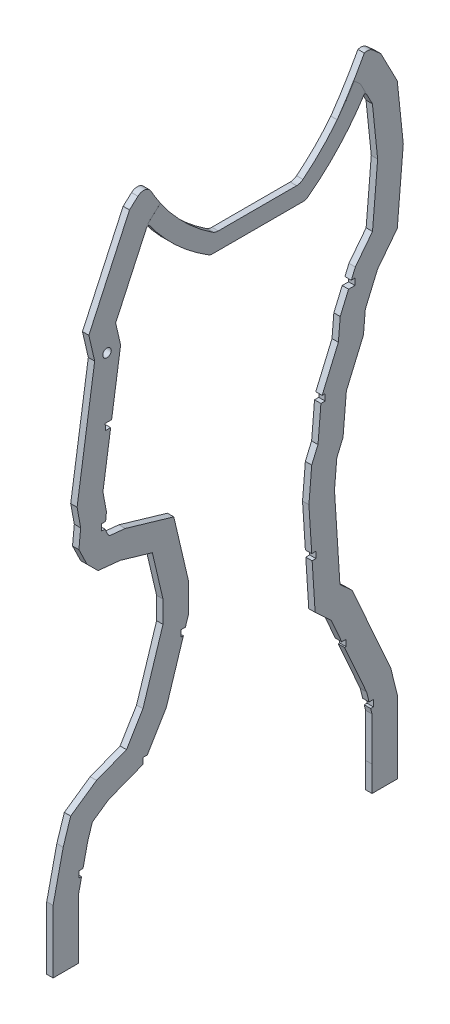
from build123d import *

# Parameters (mm, degrees)
BOSS_EXTRUDE1_DEPTH = 0.0127
BOSS_EXTRUDE2_DEPTH = 4.7625
CUT_EXTRUDE1_DEPTH  = 503.866877
CUT_EXTRUDE2_DEPTH  = 503.866877
CUT_EXTRUDE3_DEPTH  = 503.866877
CUT_EXTRUDE4_DEPTH  = 503.866756562
CUT_EXTRUDE5_DEPTH  = 503.866756562
DRAFT1_ANGLE        = -23.423733099
DRAFT2_ANGLE        = 5.115544643
DRAFT3_ANGLE        = -5.967888323
DRAFT4_ANGLE        = 5.967888323
DRAFT5_ANGLE        = 23.737346389
DRAFT6_ANGLE        = 13.699700153
DRAFT7_ANGLE        = 20.956206915
DRAFT8_ANGLE        = -0.049454377
DRAFT9_ANGLE        = 3.465221439
DRAFT10_ANGLE       = -3.465221439
DRAFT11_START       = -117
DRAFT11_OUTLINE_W   = 4.7625
DRAFT11_OUTLINE_H   = 32.392406503
DRAFT11_DEPTH       = 9.339519007
DRAFT12_ANGLE       = 0.049454377
CHAMFER1_SIZE       = 0.605241869
CHAMFER1_SIZE2      = 1.164909596
CHAMFER2_SIZE       = 9.670928998
CHAMFER2_SIZE2      = 7.254566107
CHAMFER3_SIZE       = 4.192230568
CHAMFER3_SIZE_2     = 1.781251189
CHAMFER4_SIZE       = 8.568336776
CHAMFER4_SIZE2      = 4.451775644
CHAMFER5_SIZE       = 8.906910487
CHAMFER5_SIZE2      = 12.297746559
FILLET1_R           = 5.08
FILLET2_R           = 6.35
FILLET3_R           = 7.62
SKETCH8_R           = 3.175
CUT_EXTRUDE6_DEPTH  = 503.866756562


with BuildPart() as part:
    # Sketch1 → Boss-Extrude1 (new body)
    with BuildSketch(Plane(origin=(-45.3898, 0, 0), x_dir=(0, 0, -1), z_dir=(1, 0, 0))):
        with BuildLine():
            Line((-13.027117867, 411.952661405), (58.2376066, 411.952661405))
            ThreePointArc((58.2376066, 411.952661405), (82.645894032, 433.738757071), (102.578592504, 459.682657922))
            Line((102.578592504, 459.682657922), (98.943932202, 466.704160778))
            Line((98.943932202, 466.704160778), (94.427076157, 470.71914393))
            ThreePointArc((94.427076157, 470.71914393), (76.393067454, 445.761223724), (53.975399251, 424.652661405))
            Line((53.975399251, 424.652661405), (-9.412118588, 424.652661405))
            ThreePointArc((-9.412118588, 424.652661405), (-32.493316198, 442.967669513), (-51.307892988, 465.643491556))
            Line((-51.307892988, 465.643491556), (-60.806367703, 457.019876355))
            ThreePointArc((-60.806367703, 457.019876355), (-39.331205359, 431.926509848), (-13.027117867, 411.952661405))
        make_face()
    extrude(amount=-BOSS_EXTRUDE1_DEPTH)

    # Sketch2 → Boss-Extrude2 (add)
    with BuildSketch(Plane.ZY.offset(45.4025)):
        with BuildLine():
            Line((63.098500001, 63.077602974), (63.291879008, 112.289723034))
            Line((63.291879008, 112.289723034), (60.11690352, 112.302199099))
            Line((60.11690352, 112.302199099), (45.891151151, 135.910086956))
            Line((45.891151151, 135.910086956), (29.332811414, 187.904334246))
            Line((29.332811414, 187.904334246), (29.332811414, 209.391021623))
            Line((29.332811414, 209.391021623), (40.312142586, 256.358160528))
            Line((40.312142586, 256.358160528), (76.579075699, 266.969790755))
            Line((76.579075699, 266.969790755), (88.839020466, 268.202734319))
            Line((88.839020466, 268.202734319), (91.680534506, 274.027275603))
            Line((91.680534506, 274.027275603), (91.68083764, 274.104418767))
            Line((91.68083764, 274.104418767), (94.357956542, 274.093899029))
            Line((94.357956542, 274.093899029), (94.37667064, 278.856362261))
            Line((94.37667064, 278.856362261), (91.201695152, 278.868838325))
            Line((91.201695152, 278.868838325), (91.238314866, 288.188018226))
            Line((91.238314866, 288.188018226), (93.223805533, 298.995347166))
            Line((93.223805533, 298.995347166), (80.018928963, 387.356885758))
            Line((80.018928963, 387.356885758), (83.715153611, 403.40626313))
            Line((83.715153611, 403.40626313), (60.639482355, 453.476115857))
            ThreePointArc((60.639482355, 453.476115857), (59.610055268, 454.208482516), (58.457946256, 453.690094752))
            ThreePointArc((58.457946256, 453.690094752), (37.83997486, 430.538330076), (13.027117867, 411.952661405))
            Line((13.027117867, 411.952661405), (-58.2376066, 411.952661405))
            ThreePointArc((-58.2376066, 411.952661405), (-81.896078346, 432.936686808), (-101.39751725, 457.831394844))
            ThreePointArc((-101.39751725, 457.831394844), (-102.525122265, 458.410155941), (-103.591729488, 457.725461477))
            Line((-103.591729488, 457.725461477), (-107.966767627, 449.273683253))
            Line((-107.966767627, 449.273683253), (-111.881642193, 411.593015556))
            Line((-111.881642193, 411.593015556), (-108.039976128, 366.693543428))
            Line((-108.039976128, 366.693543428), (-92.201907276, 346.218638937))
            Line((-92.201907276, 346.218638937), (-92.214201021, 343.09006127))
            Line((-92.214201021, 343.09006127), (-94.913419834, 343.100667849))
            Line((-94.913419834, 343.100667849), (-94.932133931, 338.338204617))
            Line((-94.932133931, 338.338204617), (-90.1696707, 338.31949052))
            Line((-90.1696707, 338.31949052), (-83.935257282, 323.772525879))
            Line((-83.935257282, 323.772525879), (-82.57036198, 307.820312032))
            Line((-82.57036198, 307.820312032), (-70.434794903, 279.503988853))
            Line((-70.434794903, 279.503988853), (-72.674480904, 279.512789698))
            Line((-72.674480904, 279.512789698), (-72.693195002, 274.750326466))
            Line((-72.693195002, 274.750326466), (-65.772846516, 274.72313296))
            Line((-65.772846516, 274.72313296), (-62.454891666, 235.944535654))
            Line((-62.454891666, 235.944535654), (-62.670608684, 181.0477196))
            Line((-62.670608684, 181.0477196), (-65.845584172, 181.060195665))
            Line((-65.845584172, 181.060195665), (-65.86429827, 176.297732434))
            Line((-65.86429827, 176.297732434), (-62.977705988, 176.28638957))
            Line((-62.977705988, 176.28638957), (-63.227227287, 112.786879815))
            Line((-63.227227287, 112.786879815), (-88.259006751, 112.885242183))
            Line((-88.259006751, 112.885242183), (-88.277720849, 108.122778952))
            Line((-88.277720849, 108.122778952), (-87.197024048, 108.118532354))
            Line((-87.197024048, 108.118532354), (-105.452076716, 67.044663851))
            Line((-105.452076716, 67.044663851), (-105.465062496, 63.73997343))
            Line((-105.465062496, 63.73997343), (-108.640037983, 63.752449495))
            Line((-108.640037983, 63.752449495), (-108.658752081, 58.989986263))
            Line((-108.658752081, 58.989986263), (-106.644713581, 58.9820721))
            Line((-106.644713581, 58.9820721), (-115.689979538, 22.499688915))
            Line((-115.689979538, 22.499688915), (-107.660480993, 22.492758318))
            Line((-107.660480993, 22.492758318), (-107.67690966, 3.459194076))
            Line((-107.67690966, 3.459194076), (-126.710480993, 3.459194076))
            Line((-126.710480993, 3.459194076), (-126.710480993, 66.118439508))
            Line((-126.710480993, 66.118439508), (-92.909897604, 142.169752132))
            Line((-92.909897604, 142.169752132), (-83.719650595, 150.6676735))
            Line((-83.719650595, 150.6676735), (-79.661502452, 213.586437078))
            Line((-79.661502452, 213.586437078), (-81.380621848, 233.678645015))
            Line((-81.380621848, 233.678645015), (-86.058679342, 244.5941125))
            Line((-86.058679342, 244.5941125), (-88.518059029, 273.338112591))
            Line((-88.518059029, 273.338112591), (-101.28931463, 303.137708994))
            Line((-101.28931463, 303.137708994), (-102.654209933, 319.089922841))
            Line((-102.654209933, 319.089922841), (-111.78950274, 340.405606059))
            Line((-111.78950274, 340.405606059), (-126.542147774, 359.477312393))
            Line((-126.542147774, 359.477312393), (-131.016120376, 411.766867185))
            Line((-131.016120376, 411.766867185), (-126.542147774, 454.828853484))
            Line((-126.542147774, 454.828853484), (-114.238723117, 478.596832935))
            Line((-114.238723117, 478.596832935), (-108.303962247, 483.87217593))
            ThreePointArc((-108.303962247, 483.87217593), (-105.285823641, 485.361600068), (-101.930416001, 485.099332124))
            ThreePointArc((-101.930416001, 485.099332124), (-92.271078374, 468.315288335), (-81.681786038, 452.101904447))
            ThreePointArc((-81.681786038, 452.101904447), (-68.654979704, 437.543154295), (-53.975399251, 424.652661405))
            Line((-53.975399251, 424.652661405), (9.412118588, 424.652661405))
            ThreePointArc((9.412118588, 424.652661405), (39.230903664, 450.027897644), (61.005482484, 482.569106517))
            Line((61.005482484, 482.569106517), (73.3885029, 471.326627455))
            Line((73.3885029, 471.326627455), (103.739348885, 405.471018242))
            Line((103.739348885, 405.471018242), (99.393468652, 386.600771296))
            Line((99.393468652, 386.600771296), (112.533469465, 298.673354268))
            Line((112.533469465, 298.673354268), (109.833870487, 283.979024727))
            Line((109.833870487, 283.979024727), (111.183669976, 270.557106919))
            Line((111.183669976, 270.557106919), (101.306292113, 250.310437595))
            Line((101.306292113, 250.310437595), (80.238035837, 248.191670221))
            Line((80.238035837, 248.191670221), (56.331482353, 241.196661715))
            Line((56.331482353, 241.196661715), (46.181423967, 197.776967512))
            Line((46.181423967, 197.776967512), (63.363434196, 143.824354935))
            Line((63.363434196, 143.824354935), (75.625489201, 123.475257613))
            Line((75.625489201, 123.475257613), (97.995352213, 114.806935695))
            Line((97.995352213, 114.806935695), (117.289359061, 101.385017888))
            Line((117.289359061, 101.385017888), (122.881824815, 84.048374053))
            Line((122.881824815, 84.048374053), (130.431653581, 50.213956247))
            Line((130.431653581, 50.213956247), (130.431653581, 3.237243921))
            Line((130.431653581, 3.237243921), (111.365196529, 3.237243921))
            Line((111.365196529, 3.237243921), (111.381653581, 22.303693871))
            Line((111.381653581, 22.303693871), (111.381653581, 48.114361138))
            Line((111.381653581, 48.114361138), (109.145838905, 58.134123205))
            Line((109.145838905, 58.134123205), (111.238452841, 58.125900279))
            Line((111.238452841, 58.125900279), (111.257166938, 62.888363511))
            Line((111.257166938, 62.888363511), (63.098500001, 63.077602974))
        make_face()
    extrude(amount=BOSS_EXTRUDE2_DEPTH)

    # Sketch3 → Cut-Extrude1 (cut, through all)
    with BuildSketch(Plane.ZY.offset(50.165)):
        Polygon((108.082191451, 62.900839576), (104.481099005, 79.039068683), (101.133017225, 89.418122202), (74.729088783, 107.786072422), (63.274358787, 107.831083779), (63.098500001, 63.077602974), align=None)
    extrude(amount=-CUT_EXTRUDE1_DEPTH, mode=Mode.SUBTRACT)

    # Sketch4 → Cut-Extrude2 (cut, through all)
    with BuildSketch(Plane.ZY.offset(50.165)):
        Polygon((33.153017032, 175.90864393), (34.790677515, 175.902208744), (34.809391613, 180.664671975), (31.634416125, 180.67714804), align=None)
    extrude(amount=-CUT_EXTRUDE2_DEPTH, mode=Mode.SUBTRACT)

    # Sketch5 → Cut-Extrude3 (cut, through all)
    with BuildSketch(Plane.ZY.offset(50.165)):
        Polygon((87.451452952, 337.621528381), (91.48306349, 337.605686169), (91.501777588, 342.3681494), (86.739314356, 342.386863498), align=None)
    extrude(amount=-CUT_EXTRUDE3_DEPTH, mode=Mode.SUBTRACT)

    # Sketch6 → Cut-Extrude4 (cut, through all)
    with BuildSketch(Plane(origin=(-45.4025, 0, 0), x_dir=(0, 0, -1), z_dir=(1, 0, 0))):
        Polygon((85.084031263, 112.872766118), (85.042276171, 123.498824601), (63.105427604, 143.78311228), (63.227227287, 112.786879815), align=None)
    extrude(amount=-CUT_EXTRUDE4_DEPTH, mode=Mode.SUBTRACT)

    # Sketch7 → Cut-Extrude5 (cut, through all)
    with BuildSketch(Plane(origin=(-45.4025, 0, 0), x_dir=(0, 0, -1), z_dir=(1, 0, 0))):
        Polygon((65.772846516, 274.72313296), (62.661669198, 238.361248053), (69.597567272, 254.545010226), (69.518219514, 274.737850401), align=None)
    extrude(amount=-CUT_EXTRUDE5_DEPTH, mode=Mode.SUBTRACT)

    # Draft1
    draft1_faces = [part.faces().sort_by_distance(p)[0] for p in [
        (-47.78375, 344.654350103, -92.208054149),
    ]]
    draft(draft1_faces, Plane(origin=(-50.165, 343.09006127, -92.214201021), x_dir=(0, 0.003929469288600158, -0.9999922796057528), z_dir=(0, -0.9999922796057528, -0.003929469288600158)), DRAFT1_ANGLE)

    # Draft2
    draft2_faces = [part.faces().sort_by_distance(p)[0] for p in [
        (-47.78375, 264.641430314, -69.557893393),
    ]]
    draft(draft2_faces, Plane(origin=(-50.165, 274.750326466, -72.693195002), x_dir=(0, -0.003929469288469372, 0.9999922796057533), z_dir=(0, 0.9999922796057533, 0.003929469288469372)), DRAFT2_ANGLE)

    # Draft3
    draft3_faces = [part.faces().sort_by_distance(p)[0] for p in [
        (-47.78375, 274.065847185, 91.680686073),
    ]]
    draft(draft3_faces, Plane(origin=(-50.165, 274.104418767, 91.68083764), x_dir=(0, -0.003929469288490345, 0.9999922796057532), z_dir=(0, 0.9999922796057532, 0.003929469288490345)), DRAFT3_ANGLE)

    # Draft4
    draft4_faces = [part.faces().sort_by_distance(p)[0] for p in [
        (-47.78375, 283.528428276, 91.220005009),
    ]]
    draft(draft4_faces, Plane(origin=(-50.165, 278.856362261, 94.37667064), x_dir=(0, 0.003929469288483807, -0.9999922796057532), z_dir=(0, -0.9999922796057532, -0.003929469288483807)), DRAFT4_ANGLE)

    # Draft5
    draft5_faces = [part.faces().sort_by_distance(p)[0] for p in [
        (-47.78375, 118.185795359, -85.063153717),
    ]]
    draft(draft5_faces, Plane(origin=(-50.165, 112.786879815, -63.227227287), x_dir=(0, 0.003929469288636028, -0.9999922796057527), z_dir=(0, -0.9999922796057527, -0.003929469288636028)), DRAFT5_ANGLE)

    # Draft6
    draft6_faces = [part.faces().sort_by_distance(p)[0] for p in [
        (-47.78375, 65.39231864, -105.458569606),
    ]]
    draft(draft6_faces, Plane(origin=(-50.165, 63.73997343, -105.465062496), x_dir=(0, 0.003929469288638521, -0.9999922796057527), z_dir=(0, -0.9999922796057527, -0.003929469288638521)), DRAFT6_ANGLE)

    # Draft7
    draft7_faces = [part.faces().sort_by_distance(p)[0] for p in [
        (-47.78375, 107.808578101, 69.001723785),
    ]]
    draft(draft7_faces, Plane(origin=(-50.165, 63.077602974, 63.098500001), x_dir=(0, -0.9999922796057527, -0.00392946928863582), z_dir=(0, 0.00392946928863582, -0.9999922796057527)), DRAFT7_ANGLE)

    # Draft8
    draft8_faces = [part.faces().sort_by_distance(p)[0] for p in [
        (-47.78375, 3.237243921, 120.898425055),
    ]]
    draft(draft8_faces, Plane(origin=(-50.165, 50.213956247, 130.431653581), x_dir=(1, 0, 0), z_dir=(0, 0, 1)), DRAFT8_ANGLE)

    # Draft9
    draft9_faces = [part.faces().sort_by_distance(p)[0] for p in [
        (-47.78375, 208.496127627, -62.562750175),
    ]]
    draft(draft9_faces, Plane(origin=(-50.165, 181.0477196, -62.670608684), x_dir=(0, 0.0039294692886257, -0.9999922796057527), z_dir=(0, -0.9999922796057527, -0.0039294692886257)), DRAFT9_ANGLE)

    # Draft10
    draft10_faces = [part.faces().sort_by_distance(p)[0] for p in [
        (-47.78375, 160.034750925, -63.041566796),
    ]]
    draft(draft10_faces, Plane(origin=(-50.165, 176.297732434, -65.86429827), x_dir=(0, -0.003929469288640679, 0.9999922796057527), z_dir=(0, 0.9999922796057527, 0.003929469288640679)), DRAFT10_ANGLE)

    # Draft11: read off the stored shape, not the designer's step
    # Draft11 outline → Draft11 (add)
    with BuildSketch(Plane.XY.offset(DRAFT11_START)):
        with Locations((-47.78375, 38.68896157)):
            Rectangle(DRAFT11_OUTLINE_W, DRAFT11_OUTLINE_H)
    extrude(amount=DRAFT11_DEPTH)

    # Draft12
    draft12_faces = [part.faces().sort_by_distance(p)[0] for p in [
        (-47.78375, 3.459194076, -117.193695326),
    ]]
    draft(draft12_faces, Plane(origin=(-50.165, 3.459194076, -126.710480993), x_dir=(0, -1, 0), z_dir=(0, 0, -1)), DRAFT12_ANGLE)

    # Chamfer1
    chamfer1_edges = [part.edges().sort_by_distance(p)[0] for p in [
        (-47.78375, 268.202734319, 88.839020466),
    ]]
    chamfer1_side = [part.faces().sort_by_distance(p)[0] for p in [
        (-47.78375, 267.586262537, 82.709048083),
    ]]
    chamfer(chamfer1_edges, length=CHAMFER1_SIZE, length2=CHAMFER1_SIZE2, reference=chamfer1_side[0])

    # Chamfer2
    chamfer2_edges = [part.edges().sort_by_distance(p)[0] for p in [
        (-47.78375, 197.776967512, 46.181423967),
    ]]
    chamfer2_side = [part.faces().sort_by_distance(p)[0] for p in [
        (-47.78375, 219.486814614, 51.25645316),
    ]]
    chamfer(chamfer2_edges, length=CHAMFER2_SIZE, length2=CHAMFER2_SIZE2, reference=chamfer2_side[0])

    # Chamfer3
    # the kernel refuses this chamfer: 4.192230568, 1.908890983, 1.781251189, 1.693531442 mm, written as the material it takes off along each edge
    with BuildSketch(Plane(origin=(-45.3898, 472.948594066, 43.261693123), x_dir=(-1, 0, 0), z_dir=(0, -0.6721877610222942, 0.7403807222853895))) as chamfer3_piece_1_section:
        Polygon((CHAMFER3_SIZE, 0), (0, CHAMFER3_SIZE_2), (0, 0), align=None)
    chamfer3_piece_1 = extrude(amount=34.564479699, mode=Mode.PRIVATE)
    chamfer3_piece_1 = split(chamfer3_piece_1, bisect_by=Plane(origin=(-45.4025, 472.948594066, 43.261693123), z_dir=(1, 0, 0)), keep=Keep.TOP, mode=Mode.PRIVATE)
    add(chamfer3_piece_1, mode=Mode.SUBTRACT)

    # Chamfer4
    chamfer4_edges = [part.edges().sort_by_distance(p)[0] for p in [
        (-47.78375, 250.310437595, 101.306292113),
    ]]
    chamfer4_side = [part.faces().sort_by_distance(p)[0] for p in [
        (-47.78375, 260.433772257, 106.244981045),
    ]]
    chamfer(chamfer4_edges, length=CHAMFER4_SIZE, length2=CHAMFER4_SIZE2, reference=chamfer4_side[0])

    # Chamfer5
    chamfer5_edges = [part.edges().sort_by_distance(p)[0] for p in [
        (-47.78375, 66.118439508, -126.710480993),
    ]]
    chamfer5_side = [part.faces().sort_by_distance(p)[0] for p in [
        (-47.78375, 34.788816792, -126.710480993),
    ]]
    chamfer(chamfer5_edges, length=CHAMFER5_SIZE, length2=CHAMFER5_SIZE2, reference=chamfer5_side[0])

    # Fillet1
    fillet1_edges = [part.edges().sort_by_distance(p)[0] for p in [
        (-47.7774, 411.952661405, -58.2376066),
        (-47.7774, 411.952661405, 13.027117867),
    ]]
    fillet(fillet1_edges, radius=FILLET1_R)

    # Fillet2
    fillet2_edges = [part.edges().sort_by_distance(p)[0] for p in [
        (-47.78375, 482.569106517, 61.005482484),
    ]]
    fillet(fillet2_edges, radius=FILLET2_R)

    # Fillet3
    fillet3_edges = [part.edges().sort_by_distance(p)[0] for p in [
        (-47.7774, 424.652661405, 9.412118588),
        (-47.7774, 424.652661405, -53.975399251),
    ]]
    fillet(fillet3_edges, radius=FILLET3_R)

    # Sketch8 → Cut-Extrude6 (cut, through all)
    with BuildSketch(Plane(origin=(-45.4025, 0, 0), x_dir=(0, 0, -1), z_dir=(1, 0, 0))):
        with Locations((-90.178928963, 387.356885758)):
            Circle(SKETCH8_R)
    extrude(amount=-CUT_EXTRUDE6_DEPTH, mode=Mode.SUBTRACT)


solid = part.part
